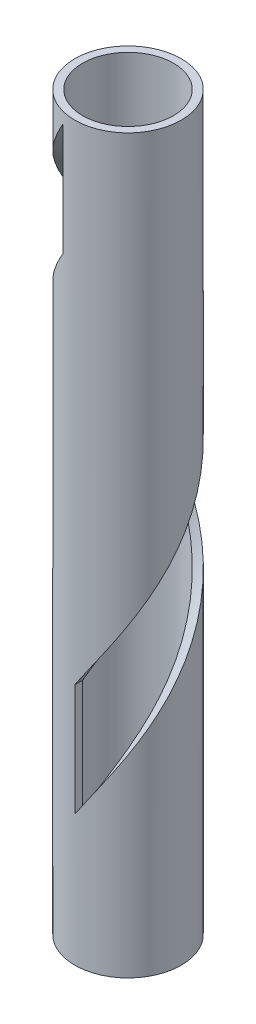
from build123d import *

# Parameters (mm, degrees)
SKETCH1_R           = 21.717
SKETCH1_R_2         = 18.542
BOSS_EXTRUDE1_DEPTH = 355.6
CUT_SWEEP1_PITCH    = 203.2
SKETCH17_R          = 21.717
CUT_EXTRUDE3_DEPTH  = 57.15


with BuildPart() as part:
    # Sketch1 → Boss-Extrude1 (new body)
    with BuildSketch(Plane(origin=(0, 0, 0), x_dir=(1, 0, 0), z_dir=(0, 1, 0))):
        with Locations(Location((0, 0, 0), (0, 0, 270))):
            Circle(SKETCH1_R)
        with Locations(Location((0, 0, 0), (0, 0, 270))):
            Circle(SKETCH1_R_2, mode=Mode.SUBTRACT)
    extrude(amount=BOSS_EXTRUDE1_DEPTH)

    # Cut-Sweep1: the profile of Sketch6 profile screwed along a right-hand helix of 0.96 turns, 42 arcs to a turn; built about Z, then put on its axis
    cut_sweep1_z = Axis((0, 0, 0), (0, 0, 1))
    cut_sweep1_corners = [(18.542, 0, -22.86), (21.7173, 0, -22.86), (21.7173, 0, 22.86), (18.542, 0, 22.86)]
    with BuildLine(mode=Mode.PRIVATE) as cut_sweep1_profile:
        Line(cut_sweep1_corners[0], cut_sweep1_corners[1])
        Line(cut_sweep1_corners[1], cut_sweep1_corners[2])
        Line(cut_sweep1_corners[2], cut_sweep1_corners[3])
        Line(cut_sweep1_corners[3], cut_sweep1_corners[0])
    cut_sweep1_cap = Face(cut_sweep1_profile.wire())
    cut_sweep1_turn_angles = [0, 4.285714286, 8.571428571, 12.857142857, 17.142857143, 21.428571429, 25.714285714, 30, 34.285714286, 38.571428571, 42.857142857, 47.142857143, 51.428571429, 55.714285714, 60, 64.285714286, 68.571428571, 72.857142857, 77.142857143, 81.428571429, 85.714285714, 90, 94.285714286, 98.571428571, 102.857142857, 107.142857143, 111.428571429, 115.714285714, 120, 124.285714286, 128.571428571, 132.857142857, 137.142857143, 141.428571429, 145.714285714, 150, 154.285714286, 158.571428571, 162.857142857, 167.142857143, 171.428571429, 175.714285714, 180, 184.285714286, 188.571428571, 192.857142857, 197.142857143, 201.428571429, 205.714285714, 210, 214.285714286, 218.571428571, 222.857142857, 227.142857143, 231.428571429, 235.714285714, 240, 244.285714286, 248.571428571, 252.857142857, 257.142857143, 261.428571429, 265.714285714, 270, 274.285714286, 278.571428571, 282.857142857, 287.142857143, 291.428571429, 295.714285714, 300, 304.285714286, 308.571428571, 312.857142857, 317.142857143, 321.428571429, 325.714285714, 330, 334.285714286, 338.571428571, 342.857142857, 344.228571429, 345.6]
    cut_sweep1_turn_weights = [1, 0.9972037971811801, 1, 0.9972037971811801, 1, 0.9972037971811801, 1, 0.9972037971811801, 1, 0.9972037971811801, 1, 0.9972037971811801, 1, 0.9972037971811801, 1, 0.9972037971811801, 1, 0.9972037971811801, 1, 0.9972037971811801, 1, 0.9972037971811801, 1, 0.9972037971811801, 1, 0.9972037971811801, 1, 0.9972037971811801, 1, 0.9972037971811801, 1, 0.9972037971811801, 1, 0.9972037971811801, 1, 0.9972037971811801, 1, 0.9972037971811801, 1, 0.9972037971811801, 1, 0.9972037971811801, 1, 0.9972037971811801, 1, 0.9972037971811801, 1, 0.9972037971811801, 1, 0.9972037971811801, 1, 0.9972037971811801, 1, 0.9972037971811801, 1, 0.9972037971811801, 1, 0.9972037971811801, 1, 0.9972037971811801, 1, 0.9972037971811801, 1, 0.9972037971811801, 1, 0.9972037971811801, 1, 0.9972037971811801, 1, 0.9972037971811801, 1, 0.9972037971811801, 1, 0.9972037971811801, 1, 0.9972037971811801, 1, 0.9972037971811801, 1, 0.9972037971811801, 1, 0.9997135489685032, 1]
    cut_sweep1_turn_rails = [Edge.make_bspline([Vector(p[0], p[1], 0).rotate(cut_sweep1_z, cut_sweep1_turn_angles[k]) / cut_sweep1_turn_weights[k] + Vector(0, 0, p[2] + CUT_SWEEP1_PITCH * cut_sweep1_turn_angles[k] / 360) for k in range(83)], [0, 0, 0, 1, 1, 2, 2, 3, 3, 4, 4, 5, 5, 6, 6, 7, 7, 8, 8, 9, 9, 10, 10, 11, 11, 12, 12, 13, 13, 14, 14, 15, 15, 16, 16, 17, 17, 18, 18, 19, 19, 20, 20, 21, 21, 22, 22, 23, 23, 24, 24, 25, 25, 26, 26, 27, 27, 28, 28, 29, 29, 30, 30, 31, 31, 32, 32, 33, 33, 34, 34, 35, 35, 36, 36, 37, 37, 38, 38, 39, 39, 40, 40, 41, 41, 41], 2, cut_sweep1_turn_weights) for p in cut_sweep1_corners]
    cut_sweep1_turn_sides = [Face.make_surface_from_curves(cut_sweep1_turn_rails[p[0]], cut_sweep1_turn_rails[p[1]]) for p in [(0, 1), (1, 2), (2, 3), (3, 0)]]
    cut_sweep1 = Plane(origin=(0, 133.35, 0), x_dir=(0, 0, 1), z_dir=(0, 1, 0)) * Solid(Shell([*cut_sweep1_turn_sides, cut_sweep1_cap, cut_sweep1_cap.rotate(cut_sweep1_z, 345.6).moved(Location((0, 0, CUT_SWEEP1_PITCH * 345.6 / 360)))]))
    add(cut_sweep1, mode=Mode.SUBTRACT)

    # Sketch17 → Cut-Extrude3 (cut)
    with BuildSketch(Plane.XZ):
        with Locations(Location((0, 0, 0), (0, 0, 270))):
            Circle(SKETCH17_R)
    extrude(amount=-CUT_EXTRUDE3_DEPTH, mode=Mode.SUBTRACT)


solid = part.part
